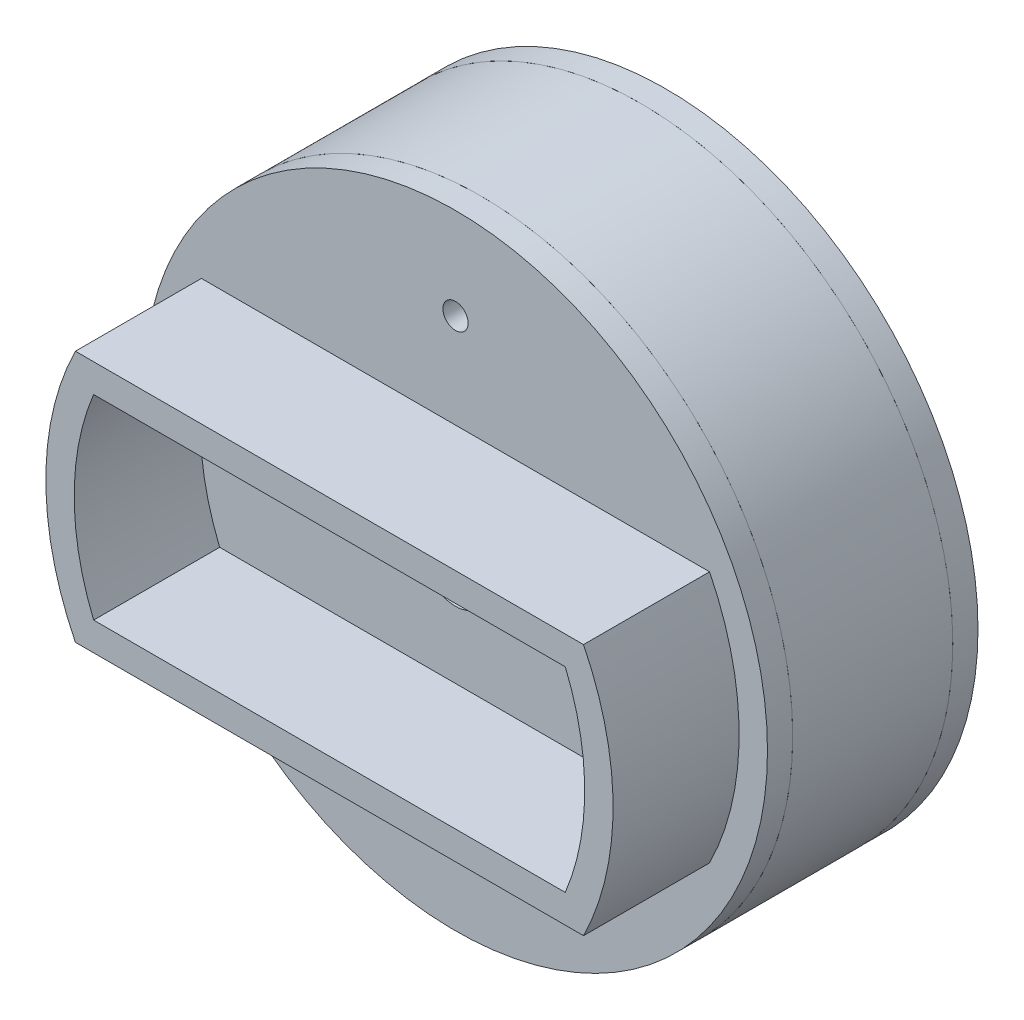
from build123d import *

# Parameters (mm, degrees)
SKETCH2_R           = 49.5
BOSS_EXTRUDE1_DEPTH = 8
SKETCH1_R           = 4.9
CUT_EXTRUDE1_DEPTH  = 29
BOSS_EXTRUDE2_DEPTH = 20
SKETCH1_14_R        = 2
CUT_EXTRUDE5_DEPTH  = 31
SKETCH6_R           = 49.5
SKETCH6_R_2         = 4.9
SKETCH6_R_3         = 2
BOSS_EXTRUDE3_DEPTH = 25.4


# Read off the part's stored shape, not the designer's step: Intersect1
with BuildPart() as part:
    # Sketch2 → Boss-Extrude1 (new body)
    with BuildSketch(Plane.XY):
        Circle(SKETCH2_R)
    extrude(amount=BOSS_EXTRUDE1_DEPTH)

    # Sketch1 → Cut-Extrude1 (cut)
    with BuildSketch(Plane(origin=(0, 0, 0), x_dir=(-1, 0, 0), z_dir=(0, 0, 1))):
        with Locations(Location((0, 0, 0), (0, 0, 180))):
            Circle(SKETCH1_R)
    extrude(amount=CUT_EXTRUDE1_DEPTH, mode=Mode.SUBTRACT)

    # Sketch4 → Boss-Extrude2 (add)
    with BuildSketch(Plane.XY.offset(8)):
        with BuildLine():
            Line((-37.416573868, 15.5), (0, 15.5))
            Line((0, 15.5), (0, 20))
            Line((0, 20), (-40.311288741, 20))
            ThreePointArc((-40.311288741, 20), (-44.933299804, 2.449197563), (-42.246301613, -15.5))
            Line((-42.246301613, -15.5), (-37.416573868, -15.5))
            ThreePointArc((-37.416573868, -15.5), (-40.5, 0), (-37.416573868, 15.5))
        make_face()
        with BuildLine():
            Line((-40.311288741, -20), (0, -20))
            Line((0, -20), (0, -15.5))
            Line((0, -15.5), (-37.416573868, -15.5))
            Line((-37.416573868, -15.5), (-42.246301613, -15.5))
            ThreePointArc((-42.246301613, -15.5), (-41.340070528, -17.776348576), (-40.311288741, -20))
        make_face()
        with BuildLine():
            Line((0, -15.5), (0, -20))
            Line((0, -20), (40.311288741, -20))
            ThreePointArc((40.311288741, -20), (41.340070528, -17.776348576), (42.246301613, -15.5))
            Line((42.246301613, -15.5), (37.416573868, -15.5))
            Line((37.416573868, -15.5), (0, -15.5))
        make_face()
        with BuildLine():
            Line((0, 20), (0, 15.5))
            Line((0, 15.5), (37.416573868, 15.5))
            ThreePointArc((37.416573868, 15.5), (40.5, 0), (37.416573868, -15.5))
            Line((37.416573868, -15.5), (42.246301613, -15.5))
            ThreePointArc((42.246301613, -15.5), (44.933299804, 2.449197563), (40.311288741, 20))
            Line((40.311288741, 20), (0, 20))
        make_face()
    extrude(amount=BOSS_EXTRUDE2_DEPTH)

    # Sketch1<14> → Cut-Extrude5 (cut)
    with BuildSketch(Plane(origin=(0, 0, 0), x_dir=(-1, 0, 0), z_dir=(0, 0, 1))):
        with Locations(Location((0, -35, 0), (0, 0, 180))):
            Circle(SKETCH1_14_R)
        with Locations(Location((0, 35, 0), (0, 0, 180))):
            Circle(SKETCH1_14_R)
    extrude(amount=CUT_EXTRUDE5_DEPTH, mode=Mode.SUBTRACT)


with BuildPart() as body_2:
    # Intersect1: the piece on the far side of the plane
    add(part.part)
    split(bisect_by=Plane.XY.offset(4), keep=Keep.BOTTOM)


with BuildPart() as part_1:
    add(part.part)

    # Intersect1
    split(bisect_by=Plane.XY.offset(4), keep=Keep.TOP)


with BuildPart() as body_2_1:
    # Body-Move/Copy1: moved
    add(body_2.part.moved(Location((0, 0, -25.4))))


with BuildPart() as body_3:
    # Sketch6 → Boss-Extrude3 (new body)
    with BuildSketch(Plane(origin=(0, 0, 4), x_dir=(-1, 0, 0), z_dir=(0, 0, -1))):
        Circle(SKETCH6_R)
        Circle(SKETCH6_R_2, mode=Mode.SUBTRACT)
        with Locations((0, -35)):
            Circle(SKETCH6_R_3, mode=Mode.SUBTRACT)
        with Locations((0, 35)):
            Circle(SKETCH6_R_3, mode=Mode.SUBTRACT)
    extrude(amount=BOSS_EXTRUDE3_DEPTH)


solid = Compound([part_1.part, body_2_1.part, body_3.part])
